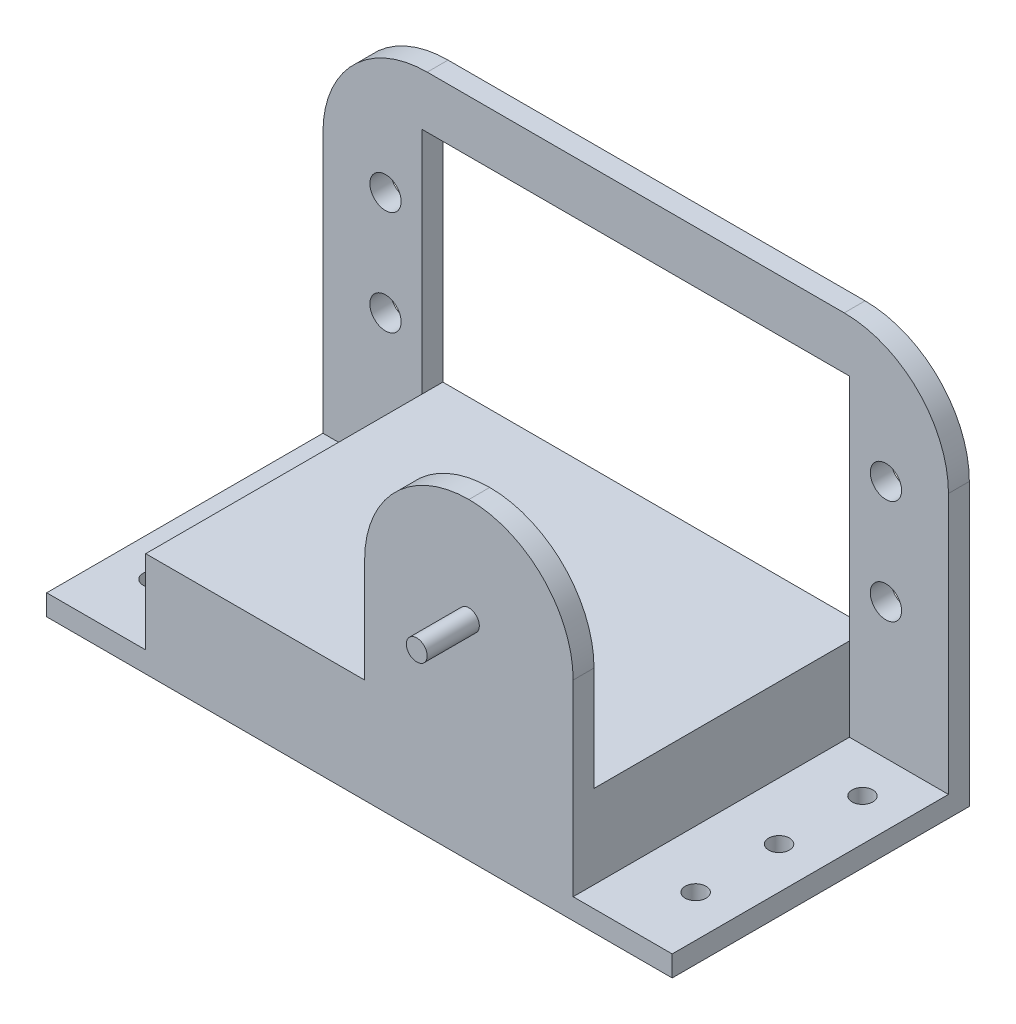
from build123d import *

# Parameters (mm, degrees)
SKETCH1_W           = 60
SKETCH1_H           = 28.5
BOSS_EXTRUDE1_DEPTH = 2
SKETCH2_W           = 60
SKETCH2_H           = 2
BOSS_EXTRUDE2_DEPTH = 35
SKETCH3_W           = 41
SKETCH3_H           = 28.5
BOSS_EXTRUDE3_DEPTH = 8
SKETCH4_W           = 20
SKETCH4_H           = 2
BOSS_EXTRUDE4_DEPTH = 20
SKETCH5_W           = 41
SKETCH5_H           = 22
CUT_EXTRUDE1_DEPTH  = 2
SKETCH6_R           = 1.5
CUT_EXTRUDE2_DEPTH  = 2
SKETCH7_R           = 1
BOSS_EXTRUDE5_DEPTH = 5
FILLET1_R           = 10
FILLET2_R           = 10
SKETCH8_R           = 1
CUT_EXTRUDE3_DEPTH  = 2


with BuildPart() as part:
    # Sketch1 → Boss-Extrude1 (new body)
    with BuildSketch(Plane(origin=(0, 0, 0), x_dir=(1, 0, 0), z_dir=(0, 1, 0))):
        Rectangle(SKETCH1_W, SKETCH1_H)
    extrude(amount=BOSS_EXTRUDE1_DEPTH)

    # Sketch2 → Boss-Extrude2 (add)
    with BuildSketch(Plane(origin=(0, 2, 0), x_dir=(1, 0, 0), z_dir=(0, 1, 0))):
        with Locations((0, 13.25)):
            Rectangle(SKETCH2_W, SKETCH2_H)
    extrude(amount=BOSS_EXTRUDE2_DEPTH)

    # Sketch3 → Boss-Extrude3 (add)
    with BuildSketch(Plane(origin=(0, 2, 0), x_dir=(1, 0, 0), z_dir=(0, 1, 0))):
        Rectangle(SKETCH3_W, SKETCH3_H)
    extrude(amount=BOSS_EXTRUDE3_DEPTH)

    # Sketch4 → Boss-Extrude4 (add)
    with BuildSketch(Plane(origin=(0, 10, 0), x_dir=(1, 0, 0), z_dir=(0, 1, 0))):
        with Locations((10.5, -13.25)):
            Rectangle(SKETCH4_W, SKETCH4_H)
    extrude(amount=BOSS_EXTRUDE4_DEPTH)

    # Sketch5 → Cut-Extrude1 (cut)
    with BuildSketch(Plane(origin=(0, 0, -14.25), x_dir=(-1, 0, 0), z_dir=(0, 0, -1))):
        with Locations((0, 21)):
            Rectangle(SKETCH5_W, SKETCH5_H)
    extrude(amount=-CUT_EXTRUDE1_DEPTH, mode=Mode.SUBTRACT)

    # Sketch6 → Cut-Extrude2 (cut)
    with BuildSketch(Plane(origin=(0, 0, -14.25), x_dir=(-1, 0, 0), z_dir=(0, 0, -1))):
        with Locations((-24, 25)):
            Circle(SKETCH6_R)
        with Locations((-24, 15)):
            Circle(SKETCH6_R)
    cut_extrude2 = extrude(amount=-CUT_EXTRUDE2_DEPTH, mode=Mode.SUBTRACT)

    # Mirror1: Cut-Extrude2 across plane
    add(cut_extrude2.mirror(Plane(origin=(0, 0, 0), x_dir=(0, 0, 1), z_dir=(1, 0, 0))), mode=Mode.SUBTRACT)

    # Sketch7 → Boss-Extrude5 (add)
    with BuildSketch(Plane.XY.offset(14.25)):
        with Locations(Location((10.5, 20, 0), (0, 0, 180))):
            Circle(SKETCH7_R)
    extrude(amount=BOSS_EXTRUDE5_DEPTH)

    # Fillet1
    fillet1_edges = [part.edges().sort_by_distance(p)[0] for p in [
        (0.5, 30, 13.25),
        (20.5, 30, 13.25),
    ]]
    fillet(fillet1_edges, radius=FILLET1_R - 0.0001)  # a hair under: the kernel refuses the full size

    # Fillet2
    fillet2_edges = [part.edges().sort_by_distance(p)[0] for p in [
        (-30, 37, -13.25),
        (30, 37, -13.25),
    ]]
    fillet(fillet2_edges, radius=FILLET2_R)

    # Sketch8 → Cut-Extrude3 (cut)
    with BuildSketch(Plane(origin=(0, 2, 0), x_dir=(1, 0, 0), z_dir=(0, 1, 0))):
        with Locations(Location((-26, 0, 0), (0, 0, 270))):
            Circle(SKETCH8_R)
        with Locations(Location((-26, 8, 0), (0, 0, 270))):
            Circle(SKETCH8_R)
        with Locations(Location((-26, -8, 0), (0, 0, 270))):
            Circle(SKETCH8_R)
    cut_extrude3 = extrude(amount=-CUT_EXTRUDE3_DEPTH, mode=Mode.SUBTRACT)

    # Mirror2: Cut-Extrude3 across plane
    add(cut_extrude3.mirror(Plane(origin=(0, 0, 0), x_dir=(0, 0, 1), z_dir=(1, 0, 0))), mode=Mode.SUBTRACT)


solid = part.part
